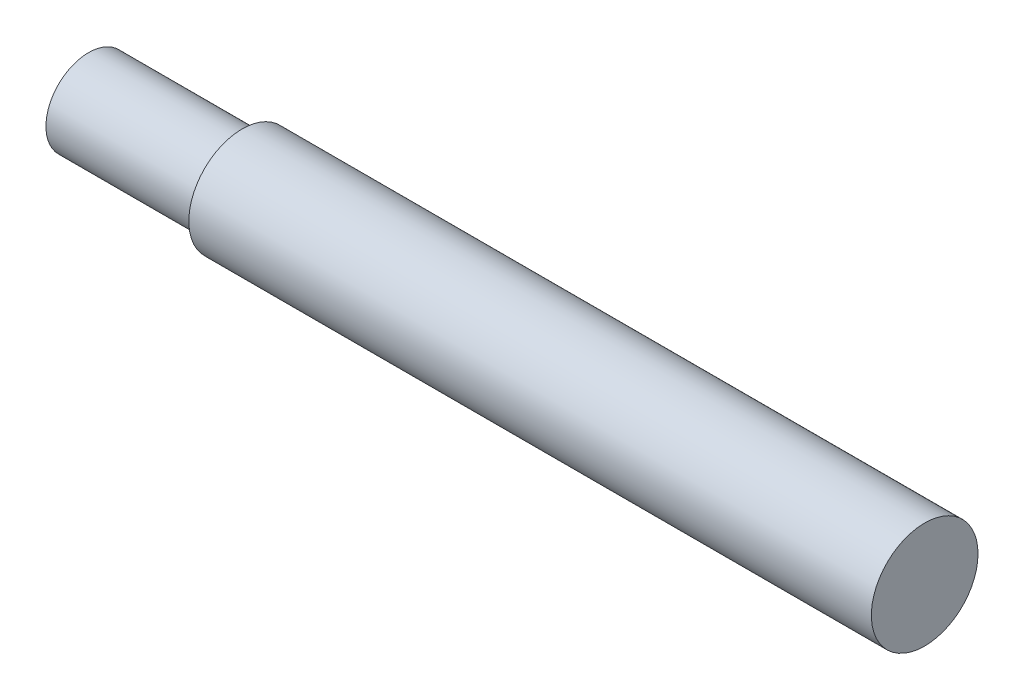
from build123d import *

# Parameters (mm, degrees)
SKETCH2_R           = 3.96875
BOSS_EXTRUDE1_DEPTH = 50.8
SKETCH3_R           = 3.175
BOSS_EXTRUDE2_DEPTH = 11.43


with BuildPart() as part:
    # Sketch2 → Boss-Extrude1 (new body)
    with BuildSketch(Plane(origin=(0, 0, 0), x_dir=(0, 0, -1), z_dir=(1, 0, 0))):
        Circle(SKETCH2_R)
    extrude(amount=BOSS_EXTRUDE1_DEPTH)

    # Sketch3 → Boss-Extrude2 (add)
    with BuildSketch(Plane(origin=(0, 0, 0), x_dir=(0, 0, -1), z_dir=(1, 0, 0))):
        Circle(SKETCH3_R)
    extrude(amount=-BOSS_EXTRUDE2_DEPTH)


solid = part.part
